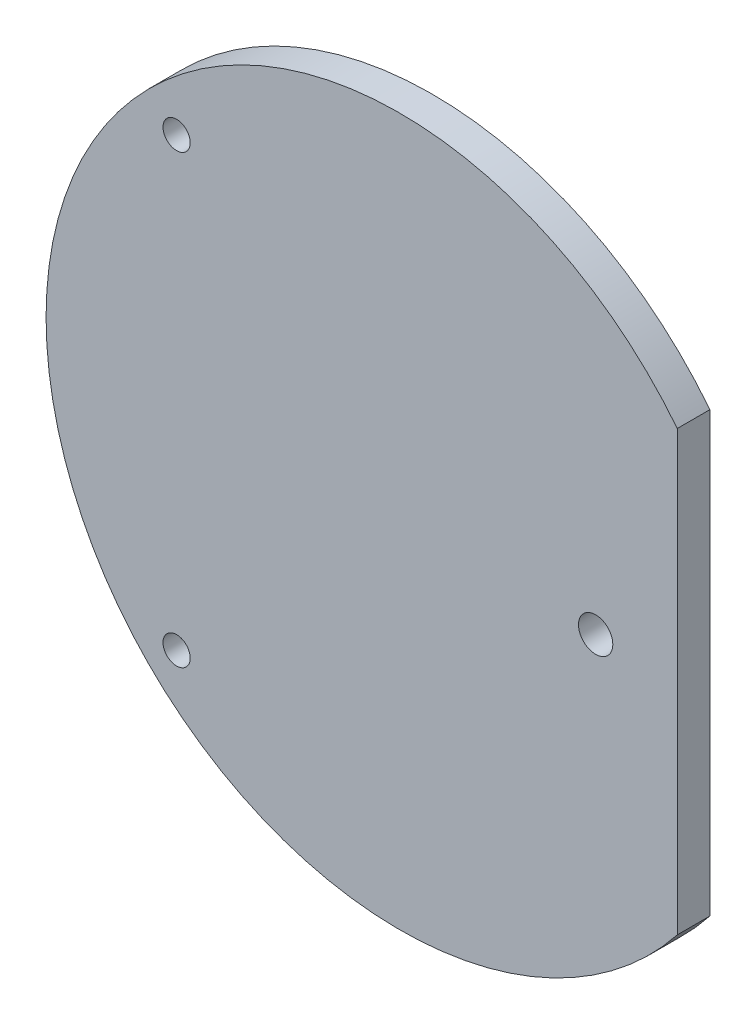
from build123d import *

# Parameters (mm, degrees)
SKETCH_1_R               = 32.5
EXTRUDE_1_DEPTH          = 3
PATTERN_CIRCULAR_4_COUNT = 2
PATTERN_CIRCULAR_4_ANGLE = 90
CUT_EXTRUDE_2_DEPTH      = 10
HOLE_WIZARD_M31_D        = 3.15
HOLE_WIZARD_M31_DEPTH    = 7
HOLE_WIZARD_M31_TIP      = 0.946355475


with BuildPart() as part:
    # Эскиз1 → Бобышка-Вытянуть1 (new body)
    with BuildSketch(Plane.XY):
        Circle(SKETCH_1_R)
    extrude(amount=EXTRUDE_1_DEPTH)

    # Эскиз3 → Сверление под метчик M3x0.51 (revolve, cut)
    with BuildSketch(Plane(origin=(-20.506096654, 20.506096654, 3), x_dir=(0, -1, 0), z_dir=(1, 0, 0))):
        Polygon((0, 0), (0, 7.751075774), (1.25, 7), (1.25, 0), align=None)
    m3x0_51 = revolve(axis=Axis((-20.506096654, 20.506096654, 9.35), (0, 0, -1)), mode=Mode.SUBTRACT)

    # Круговой массив4: Сверление под метчик M3x0.51 ×2 about axis
    pattern_circular_4_axis = Axis((0, 0, 3), (0, 0, 1))
    for i in range(1, PATTERN_CIRCULAR_4_COUNT):
        add(m3x0_51.rotate(pattern_circular_4_axis, i * PATTERN_CIRCULAR_4_ANGLE / (PATTERN_CIRCULAR_4_COUNT - 1)), mode=Mode.SUBTRACT)

    # Эскиз5 → Вырез-Вытянуть2 (cut)
    with BuildSketch(Plane(origin=(0, 0, 0), x_dir=(-1, 0, 0), z_dir=(0, 0, -1))):
        with BuildLine():
            Line((-25.5, -20.14944168), (-25.5, 20.14944168))
            ThreePointArc((-25.5, 20.14944168), (-32.5, 0), (-25.5, -20.14944168))
        make_face()
    extrude(amount=-CUT_EXTRUDE_2_DEPTH, mode=Mode.SUBTRACT)

    # Сверло под метчик  спиральное M31
    with Locations(Plane.XY.offset(3)):
        with Locations((18, 0)):
            Hole(HOLE_WIZARD_M31_D / 2, depth=HOLE_WIZARD_M31_DEPTH)
            with Locations((0, 0, -(HOLE_WIZARD_M31_DEPTH + HOLE_WIZARD_M31_TIP / 2))):  # 118° drill point
                Cone(0, HOLE_WIZARD_M31_D / 2, HOLE_WIZARD_M31_TIP, mode=Mode.SUBTRACT)


solid = part.part
